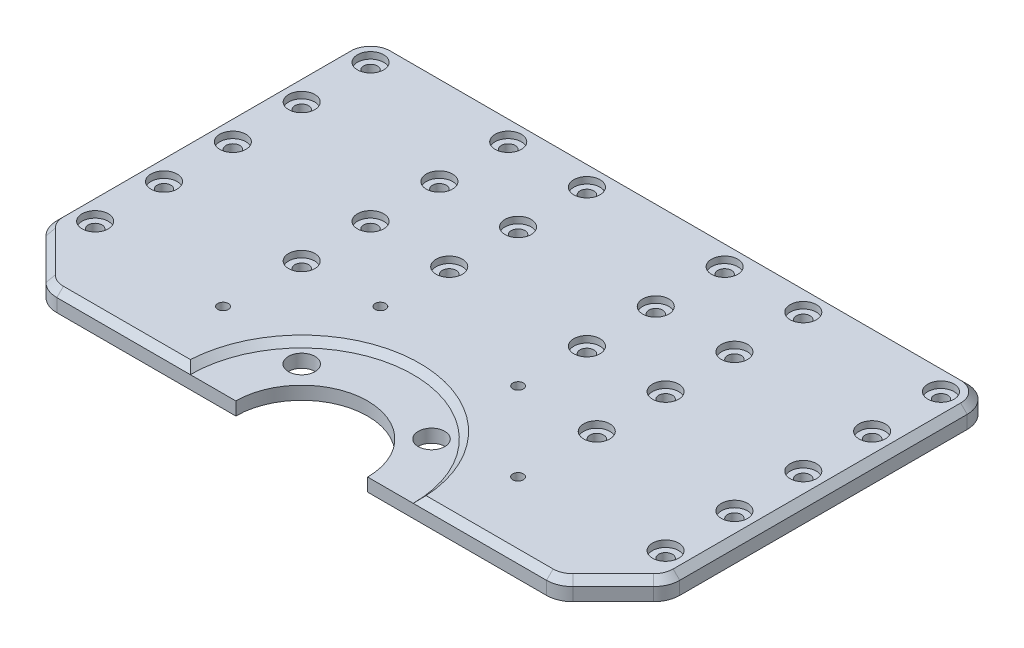
from build123d import *

# Parameters (mm, degrees)
EXTRUDE_1_DEPTH               = 3
HOLE_WIZARD_M2_1_AT_2_COUNT   = 2
HOLE_WIZARD_M2_1_AT_2_PITCH   = 21
PATTERN_LINEAR_1_COUNT        = 3
PATTERN_LINEAR_1_PITCH        = 33
PATTERN_LINEAR_2_COUNT        = 3
PATTERN_LINEAR_2_PITCH        = 10.5
PATTERN_LINEAR_3_COUNT        = 2
PATTERN_LINEAR_3_PITCH        = 31.5
HOLE_WIZARD_M2_1_2_AT_2_COUNT = 2
HOLE_WIZARD_M2_1_2_AT_2_PITCH = 16.970562748
SKETCH_8_R                    = 17
CUT_EXTRUDE_1_DEPTH           = 1
SKETCH_9_R                    = 2.025
CUT_EXTRUDE_2_DEPTH           = 75.994999833
PATTERN_CIRCULAR_1_COUNT      = 2
PATTERN_CIRCULAR_1_ANGLE      = 90
FILLET_1_R                    = 4
CHAMFER_1_SIZE                = 1


with BuildPart() as part:
    # ｽｹｯﾁ1 → ﾎﾞｽ - 押し出し1 (new body)
    with BuildSketch(Plane(origin=(0, 0, 0), x_dir=(1, 0, 0), z_dir=(0, 1, 0))):
        with BuildLine():
            Line((-10.05, 0), (-39, 0))
            Line((-39, 0), (-47.5, 8.5))
            Line((-47.5, 8.5), (-47.5, 58))
            Line((-47.5, 58), (47.5, 58))
            Line((47.5, 58), (47.5, 8.5))
            Line((47.5, 8.5), (39, 0))
            Line((39, 0), (10.05, 0))
            ThreePointArc((10.05, 0), (0, 10.05), (-10.05, 0))
        make_face()
    extrude(amount=EXTRUDE_1_DEPTH)

    # ｽｹｯﾁ3 → Hole Wizard M2 _1 (revolve, cut)
    with BuildSketch(Plane(origin=(-43.5, 3, -54), x_dir=(0, 0, 1), z_dir=(1, 0, 0))):
        Polygon((0, 0), (0, 4.63090365), (1.05, 4), (1.05, 1), (2, 1), (2, 0), align=None)
    hole_wizard_m2_1 = revolve(axis=Axis((-43.5, 9.35, -54), (0, -1, 0)), mode=Mode.SUBTRACT)

    # Hole Wizard M2 _1 at 2: Hole Wizard M2 _1 ×2
    with Locations(*[(i * HOLE_WIZARD_M2_1_AT_2_PITCH, 0, 0) for i in range(1, HOLE_WIZARD_M2_1_AT_2_COUNT)]):
        add(hole_wizard_m2_1, mode=Mode.SUBTRACT)

    # 直線ﾊﾟﾀｰﾝ1: Hole Wizard M2 _1 ×3
    with Locations(*[(i * PATTERN_LINEAR_1_PITCH, 0, 0) for i in range(1, PATTERN_LINEAR_1_COUNT)]):
        add(hole_wizard_m2_1, mode=Mode.SUBTRACT)

    # 直線ﾊﾟﾀｰﾝ1 copy 1 sketch → 直線ﾊﾟﾀｰﾝ1 copy 1 (revolve, cut)
    with BuildSketch(Plane(origin=(10.5, 3, -54), x_dir=(0, 0, 1), z_dir=(1, 0, 0))):
        Polygon((0, 0), (0, 4.63090365), (1.05, 4), (1.05, 1), (2, 1), (2, 0), align=None)
    revolve(axis=Axis((10.5, 9.35, -54), (0, -1, 0)), mode=Mode.SUBTRACT)

    # 直線ﾊﾟﾀｰﾝ1 copy 2 sketch → 直線ﾊﾟﾀｰﾝ1 copy 2 (revolve, cut)
    with BuildSketch(Plane(origin=(43.5, 3, -54), x_dir=(0, 0, 1), z_dir=(1, 0, 0))):
        Polygon((0, 0), (0, 4.63090365), (1.05, 4), (1.05, 1), (2, 1), (2, 0), align=None)
    revolve(axis=Axis((43.5, 9.35, -54), (0, -1, 0)), mode=Mode.SUBTRACT)

    # 直線ﾊﾟﾀｰﾝ2: Hole Wizard M2 _1 ×3
    with Locations(*[(0, 0, i * PATTERN_LINEAR_2_PITCH) for i in range(1, PATTERN_LINEAR_2_COUNT)]):
        add(hole_wizard_m2_1, mode=Mode.SUBTRACT)

    # 直線ﾊﾟﾀｰﾝ2 copy 1 sketch → 直線ﾊﾟﾀｰﾝ2 copy 1 (revolve, cut)
    with BuildSketch(Plane(origin=(-22.5, 3, -43.5), x_dir=(0, 0, 1), z_dir=(1, 0, 0))):
        Polygon((0, 0), (0, 4.63090365), (1.05, 4), (1.05, 1), (2, 1), (2, 0), align=None)
    revolve(axis=Axis((-22.5, 9.35, -43.5), (0, -1, 0)), mode=Mode.SUBTRACT)

    # 直線ﾊﾟﾀｰﾝ2 copy 2 sketch → 直線ﾊﾟﾀｰﾝ2 copy 2 (revolve, cut)
    with BuildSketch(Plane(origin=(-22.5, 3, -33), x_dir=(0, 0, 1), z_dir=(1, 0, 0))):
        Polygon((0, 0), (0, 4.63090365), (1.05, 4), (1.05, 1), (2, 1), (2, 0), align=None)
    revolve(axis=Axis((-22.5, 9.35, -33), (0, -1, 0)), mode=Mode.SUBTRACT)

    # 直線ﾊﾟﾀｰﾝ2 copy 3 sketch → 直線ﾊﾟﾀｰﾝ2 copy 3 (revolve, cut)
    with BuildSketch(Plane(origin=(-10.5, 3, -43.5), x_dir=(0, 0, 1), z_dir=(1, 0, 0))):
        Polygon((0, 0), (0, 4.63090365), (1.05, 4), (1.05, 1), (2, 1), (2, 0), align=None)
    revolve(axis=Axis((-10.5, 9.35, -43.5), (0, -1, 0)), mode=Mode.SUBTRACT)

    # 直線ﾊﾟﾀｰﾝ2 copy 4 sketch → 直線ﾊﾟﾀｰﾝ2 copy 4 (revolve, cut)
    with BuildSketch(Plane(origin=(-10.5, 3, -33), x_dir=(0, 0, 1), z_dir=(1, 0, 0))):
        Polygon((0, 0), (0, 4.63090365), (1.05, 4), (1.05, 1), (2, 1), (2, 0), align=None)
    revolve(axis=Axis((-10.5, 9.35, -33), (0, -1, 0)), mode=Mode.SUBTRACT)

    # 直線ﾊﾟﾀｰﾝ2 copy 5 sketch → 直線ﾊﾟﾀｰﾝ2 copy 5 (revolve, cut)
    with BuildSketch(Plane(origin=(22.5, 3, -43.5), x_dir=(0, 0, 1), z_dir=(1, 0, 0))):
        Polygon((0, 0), (0, 4.63090365), (1.05, 4), (1.05, 1), (2, 1), (2, 0), align=None)
    revolve(axis=Axis((22.5, 9.35, -43.5), (0, -1, 0)), mode=Mode.SUBTRACT)

    # 直線ﾊﾟﾀｰﾝ2 copy 6 sketch → 直線ﾊﾟﾀｰﾝ2 copy 6 (revolve, cut)
    with BuildSketch(Plane(origin=(22.5, 3, -33), x_dir=(0, 0, 1), z_dir=(1, 0, 0))):
        Polygon((0, 0), (0, 4.63090365), (1.05, 4), (1.05, 1), (2, 1), (2, 0), align=None)
    revolve(axis=Axis((22.5, 9.35, -33), (0, -1, 0)), mode=Mode.SUBTRACT)

    # 直線ﾊﾟﾀｰﾝ2 copy 7 sketch → 直線ﾊﾟﾀｰﾝ2 copy 7 (revolve, cut)
    with BuildSketch(Plane(origin=(10.5, 3, -43.5), x_dir=(0, 0, 1), z_dir=(1, 0, 0))):
        Polygon((0, 0), (0, 4.63090365), (1.05, 4), (1.05, 1), (2, 1), (2, 0), align=None)
    revolve(axis=Axis((10.5, 9.35, -43.5), (0, -1, 0)), mode=Mode.SUBTRACT)

    # 直線ﾊﾟﾀｰﾝ2 copy 8 sketch → 直線ﾊﾟﾀｰﾝ2 copy 8 (revolve, cut)
    with BuildSketch(Plane(origin=(10.5, 3, -33), x_dir=(0, 0, 1), z_dir=(1, 0, 0))):
        Polygon((0, 0), (0, 4.63090365), (1.05, 4), (1.05, 1), (2, 1), (2, 0), align=None)
    revolve(axis=Axis((10.5, 9.35, -33), (0, -1, 0)), mode=Mode.SUBTRACT)

    # 直線ﾊﾟﾀｰﾝ2 copy 9 sketch → 直線ﾊﾟﾀｰﾝ2 copy 9 (revolve, cut)
    with BuildSketch(Plane(origin=(43.5, 3, -43.5), x_dir=(0, 0, 1), z_dir=(1, 0, 0))):
        Polygon((0, 0), (0, 4.63090365), (1.05, 4), (1.05, 1), (2, 1), (2, 0), align=None)
    revolve(axis=Axis((43.5, 9.35, -43.5), (0, -1, 0)), mode=Mode.SUBTRACT)

    # 直線ﾊﾟﾀｰﾝ2 copy 10 sketch → 直線ﾊﾟﾀｰﾝ2 copy 10 (revolve, cut)
    with BuildSketch(Plane(origin=(43.5, 3, -33), x_dir=(0, 0, 1), z_dir=(1, 0, 0))):
        Polygon((0, 0), (0, 4.63090365), (1.05, 4), (1.05, 1), (2, 1), (2, 0), align=None)
    revolve(axis=Axis((43.5, 9.35, -33), (0, -1, 0)), mode=Mode.SUBTRACT)

    # 直線ﾊﾟﾀｰﾝ3: Hole Wizard M2 _1 ×2
    with Locations(*[(0, 0, i * PATTERN_LINEAR_3_PITCH) for i in range(1, PATTERN_LINEAR_3_COUNT)]):
        add(hole_wizard_m2_1, mode=Mode.SUBTRACT)

    # 直線ﾊﾟﾀｰﾝ3 copy 1 sketch → 直線ﾊﾟﾀｰﾝ3 copy 1 (revolve, cut)
    with BuildSketch(Plane(origin=(-22.5, 3, -22.5), x_dir=(0, 0, 1), z_dir=(1, 0, 0))):
        Polygon((0, 0), (0, 4.63090365), (1.05, 4), (1.05, 1), (2, 1), (2, 0), align=None)
    revolve(axis=Axis((-22.5, 9.35, -22.5), (0, -1, 0)), mode=Mode.SUBTRACT)

    # ｽｹｯﾁ5 → Hole Wizard M2 _1 2 (revolve, cut)
    with BuildSketch(Plane(origin=(-10.5, 3, -22.5), x_dir=(0, 0, 1), z_dir=(1, 0, 0))):
        Polygon((0, 0), (0, 6.480688495), (0.8, 6), (0.8, 0), align=None)
    hole_wizard_m2_1_2 = revolve(axis=Axis((-10.5, 9.35, -22.5), (0, -1, 0)), mode=Mode.SUBTRACT)

    # Hole Wizard M2 _1 2 at 2: Hole Wizard M2 _1 2 ×2
    with Locations(*[Vector(-0.7071067811865469, 0, 0.7071067811865482) * (i * HOLE_WIZARD_M2_1_2_AT_2_PITCH) for i in range(1, HOLE_WIZARD_M2_1_2_AT_2_COUNT)]):
        add(hole_wizard_m2_1_2, mode=Mode.SUBTRACT)

    # ｽｹｯﾁ7 → M2 なべ頭ねじ用座ぐり穴2 (revolve, cut)
    with BuildSketch(Plane(origin=(-43.5, 3, -12), x_dir=(0, 0, 1), z_dir=(1, 0, 0))):
        Polygon((0, 0), (0, 6.63090365), (1.05, 6), (1.05, 1), (2, 1), (2, 0), align=None)
    hole_wizard_m2_2 = revolve(axis=Axis((-43.5, 9.35, -12), (0, -1, 0)), mode=Mode.SUBTRACT)

    # ﾐﾗｰ1: Hole Wizard M2 _1 2, M2 なべ頭ねじ用座ぐり穴2 across plane
    add(hole_wizard_m2_1_2.mirror(Plane(origin=(0, 0, 0), x_dir=(0, 0, 1), z_dir=(1, 0, 0))), mode=Mode.SUBTRACT)
    add(hole_wizard_m2_2.mirror(Plane(origin=(0, 0, 0), x_dir=(0, 0, 1), z_dir=(1, 0, 0))), mode=Mode.SUBTRACT)

    # ﾐﾗｰ1 copy 1 sketch → ﾐﾗｰ1 copy 1 (revolve, cut)
    with BuildSketch(Plane(origin=(43.5, 3, -22.5), x_dir=(0, 0, 1), z_dir=(-1, 0, 0))):
        Polygon((0, 0), (0, -4.63090365), (1.05, -4), (1.05, -1), (2, -1), (2, 0), align=None)
    revolve(axis=Axis((43.5, 9.35, -22.5), (0, 1, 0)), mode=Mode.SUBTRACT)

    # ﾐﾗｰ1 copy 2 sketch → ﾐﾗｰ1 copy 2 (revolve, cut)
    with BuildSketch(Plane(origin=(22.5, 3, -22.5), x_dir=(0, 0, 1), z_dir=(-1, 0, 0))):
        Polygon((0, 0), (0, -4.63090365), (1.05, -4), (1.05, -1), (2, -1), (2, 0), align=None)
    revolve(axis=Axis((22.5, 9.35, -22.5), (0, 1, 0)), mode=Mode.SUBTRACT)

    # ﾐﾗｰ1 copy 3 sketch → ﾐﾗｰ1 copy 3 (revolve, cut)
    with BuildSketch(Plane(origin=(43.5, 3, -54), x_dir=(0, 0, 1), z_dir=(-1, 0, 0))):
        Polygon((0, 0), (0, -4.63090365), (1.05, -4), (1.05, -1), (2, -1), (2, 0), align=None)
    revolve(axis=Axis((43.5, 9.35, -54), (0, 1, 0)), mode=Mode.SUBTRACT)

    # ﾐﾗｰ1 copy 4 sketch → ﾐﾗｰ1 copy 4 (revolve, cut)
    with BuildSketch(Plane(origin=(22.5, 3, -54), x_dir=(0, 0, 1), z_dir=(-1, 0, 0))):
        Polygon((0, 0), (0, -4.63090365), (1.05, -4), (1.05, -1), (2, -1), (2, 0), align=None)
    revolve(axis=Axis((22.5, 9.35, -54), (0, 1, 0)), mode=Mode.SUBTRACT)

    # ﾐﾗｰ1 copy 5 sketch → ﾐﾗｰ1 copy 5 (revolve, cut)
    with BuildSketch(Plane(origin=(22.5, 3, -10.5), x_dir=(0, 0, 1), z_dir=(-1, 0, 0))):
        Polygon((0, 0), (0, -6.480688495), (0.8, -6), (0.8, 0), align=None)
    revolve(axis=Axis((22.5, 9.35, -10.5), (0, 1, 0)), mode=Mode.SUBTRACT)

    # ｽｹｯﾁ8 → ｶｯﾄ - 押し出し1 (cut)
    with BuildSketch(Plane(origin=(0, 3, 0), x_dir=(1, 0, 0), z_dir=(0, 1, 0))):
        Circle(SKETCH_8_R)
    extrude(amount=-CUT_EXTRUDE_1_DEPTH, mode=Mode.SUBTRACT)

    # ｽｹｯﾁ9 → ｶｯﾄ - 押し出し2 (cut, through all)
    with BuildSketch(Plane(origin=(0, 2, 0), x_dir=(1, 0, 0), z_dir=(0, 1, 0))):
        with Locations(Location((-9.899494937, 9.899494937, 0), (0, 0, 270))):
            Circle(SKETCH_9_R)
    cut_extrude_2 = extrude(amount=-CUT_EXTRUDE_2_DEPTH, mode=Mode.SUBTRACT)

    # 円形ﾊﾟﾀｰﾝ1: ｶｯﾄ - 押し出し2 ×2 about axis
    pattern_circular_1_axis = Axis((0, 3, 0), (0, -1, 0))
    for i in range(1, PATTERN_CIRCULAR_1_COUNT):
        add(cut_extrude_2.rotate(pattern_circular_1_axis, i * PATTERN_CIRCULAR_1_ANGLE / (PATTERN_CIRCULAR_1_COUNT - 1)), mode=Mode.SUBTRACT)

    # ﾌｨﾚｯﾄ1
    fillet_1_edges = [part.edges().sort_by_distance(p)[0] for p in [
        (-47.5, 1.5, -8.5),
        (-47.5, 1.5, -58),
        (47.5, 1.5, -58),
        (47.5, 1.5, -8.5),
        (39, 1.5, 0),
        (-39, 1.5, 0),
    ]]
    fillet(fillet_1_edges, radius=FILLET_1_R)

    # 面取り1
    chamfer_1_edges = [part.edges().sort_by_distance(p)[0] for p in [
        (0, 3, -17),
        (27.171572875, 3, 0),
        (38.87387948, 3, -0.30448187),
        (43.25, 3, -4.25),
        (47.19551813, 3, -8.62612052),
        (47.5, 3, -32.078427125),
        (-27.171572875, 3, 0),
        (46.328427125, 3, -56.828427125),
        (-38.87387948, 3, -0.30448187),
        (0, 3, -58),
        (-43.25, 3, -4.25),
        (-46.328427125, 3, -56.828427125),
        (-47.19551813, 3, -8.62612052),
        (-47.5, 3, -32.078427125),
    ]]
    chamfer(chamfer_1_edges, length=CHAMFER_1_SIZE - 0.0001)  # a hair under: the kernel refuses the full size


solid = part.part
